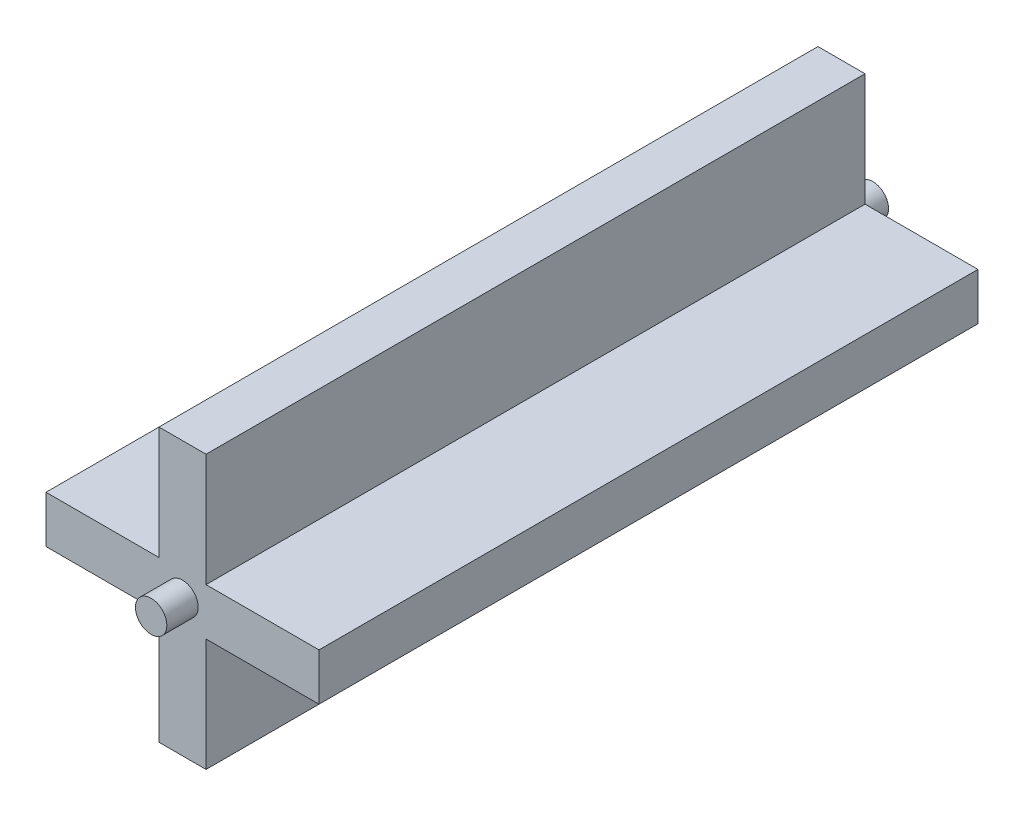
from build123d import *

# Parameters (mm, degrees)
BOSS_EXTRUDE1_DEPTH = 105
SKETCH2_R           = 5
BOSS_EXTRUDE2_DEPTH = 10


with BuildPart() as part:
    # Sketch1 → Boss-Extrude1 (new, symmetric)
    with BuildSketch(Plane.XY):
        Polygon((-7.5, 7.5), (-7.5, 43.5), (7.5, 43.5), (7.5, 7.5), (43.5, 7.5), (43.5, -7.5), (7.5, -7.5), (7.5, -43.5), (-7.5, -43.5), (-7.5, -7.5), (-43.5, -7.5), (-43.5, 7.5), align=None)
    extrude(amount=BOSS_EXTRUDE1_DEPTH, both=True)

    # Sketch2 → Boss-Extrude2 (add)
    with BuildSketch(Plane.XY.offset(105)):
        Circle(SKETCH2_R)
    boss_extrude2 = extrude(amount=BOSS_EXTRUDE2_DEPTH)

    # Mirror1: Boss-Extrude2 across plane
    add(boss_extrude2.mirror(Plane.XY))


solid = part.part
